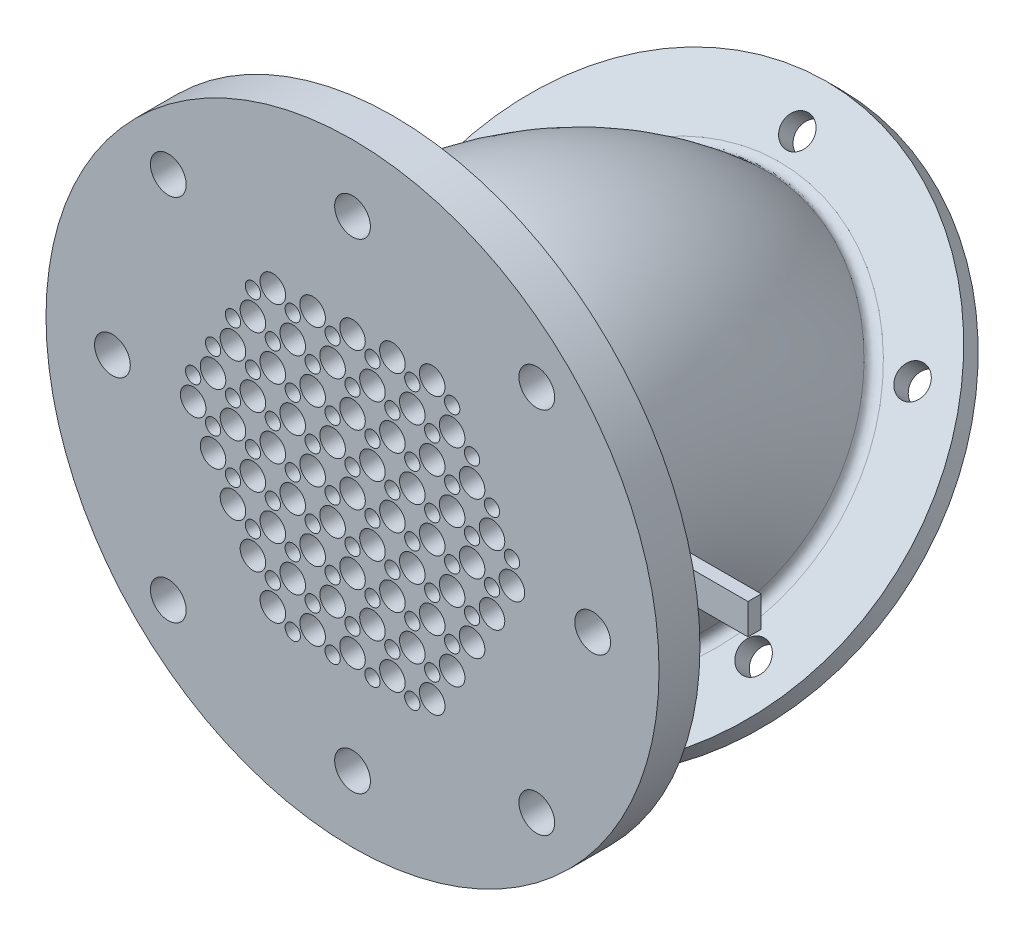
from build123d import *

# Parameters (mm, degrees)
SKETCH1_R           = 18.646817389
SKETCH1_R_2         = 1.25
SKETCH1_R_3         = 0.75
SKETCH5_R           = 30
SKETCH5_R_2         = 17.173669099
BOSS_EXTRUDE1_DEPTH = 4
FILLET1_R           = 2
SKETCH6_R           = 1.75
CUT_EXTRUDE2_DEPTH  = 5
SKETCH8_R           = 1.75
CUT_EXTRUDE3_DEPTH  = 5
SKETCH10_W          = 107.605507763
SKETCH10_H          = 80.053599659
CUT_EXTRUDE4_DEPTH  = 50
SKETCH12_W          = 12.253266611
SKETCH12_H          = 1.3
BOSS_EXTRUDE3_DEPTH = 1.5
SKETCH15_R          = 26
SKETCH15_R_2        = 17.590578727
BOSS_EXTRUDE6_DEPTH = 2
SKETCH16_R          = 1.5
CUT_EXTRUDE5_DEPTH  = 2
FILLET2_R           = 1


with BuildPart() as part:
    # Sweep1: sweep along a path in Sketch2
    with BuildLine(Plane(origin=(0, 0, 0), x_dir=(0, 0, -1), z_dir=(1, 0, 0))) as sweep1_path:
        Line((0, 0), (10, 0))
        ThreePointArc((10, 0), (29.391260893, -8.032123253), (37.423384146, -27.423384146))
        Line((37.423384146, -27.423384146), (37.423384146, -34.423384146))
    # Sketch1 → Sweep1 (sweep)
    with BuildSketch(Plane.XY):
        Circle(SKETCH1_R)
        Circle(SKETCH1_R_2, mode=Mode.SUBTRACT)
        with Locations((3.9, 0)):
            Circle(SKETCH1_R_2, mode=Mode.SUBTRACT)
        with Locations((7.8, 0)):
            Circle(SKETCH1_R_2, mode=Mode.SUBTRACT)
        with Locations((11.7, 0)):
            Circle(SKETCH1_R_2, mode=Mode.SUBTRACT)
        with Locations((15.6, 0)):
            Circle(SKETCH1_R_2, mode=Mode.SUBTRACT)
        with Locations((1.95, -3.377499075)):
            Circle(SKETCH1_R_2, mode=Mode.SUBTRACT)
        with Locations((3.9, -6.75499815)):
            Circle(SKETCH1_R_2, mode=Mode.SUBTRACT)
        with Locations((5.85, -10.132497224)):
            Circle(SKETCH1_R_2, mode=Mode.SUBTRACT)
        with Locations((7.8, -13.509996299)):
            Circle(SKETCH1_R_2, mode=Mode.SUBTRACT)
        with Locations((-1.95, -3.377499075)):
            Circle(SKETCH1_R_2, mode=Mode.SUBTRACT)
        with Locations((-3.9, -6.75499815)):
            Circle(SKETCH1_R_2, mode=Mode.SUBTRACT)
        with Locations((-5.85, -10.132497224)):
            Circle(SKETCH1_R_2, mode=Mode.SUBTRACT)
        with Locations((-7.8, -13.509996299)):
            Circle(SKETCH1_R_2, mode=Mode.SUBTRACT)
        with Locations((-3.9, 0)):
            Circle(SKETCH1_R_2, mode=Mode.SUBTRACT)
        with Locations((-7.8, 0)):
            Circle(SKETCH1_R_2, mode=Mode.SUBTRACT)
        with Locations((-11.7, 0)):
            Circle(SKETCH1_R_2, mode=Mode.SUBTRACT)
        with Locations((-15.6, 0)):
            Circle(SKETCH1_R_2, mode=Mode.SUBTRACT)
        with Locations((-1.95, 3.377499075)):
            Circle(SKETCH1_R_2, mode=Mode.SUBTRACT)
        with Locations((-3.9, 6.75499815)):
            Circle(SKETCH1_R_2, mode=Mode.SUBTRACT)
        with Locations((-5.85, 10.132497224)):
            Circle(SKETCH1_R_2, mode=Mode.SUBTRACT)
        with Locations((-7.8, 13.509996299)):
            Circle(SKETCH1_R_2, mode=Mode.SUBTRACT)
        with Locations((1.95, 3.377499075)):
            Circle(SKETCH1_R_2, mode=Mode.SUBTRACT)
        with Locations((3.9, 6.75499815)):
            Circle(SKETCH1_R_2, mode=Mode.SUBTRACT)
        with Locations((5.85, 10.132497224)):
            Circle(SKETCH1_R_2, mode=Mode.SUBTRACT)
        with Locations((7.8, 13.509996299)):
            Circle(SKETCH1_R_2, mode=Mode.SUBTRACT)
        with Locations((5.85, 3.377499075)):
            Circle(SKETCH1_R_2, mode=Mode.SUBTRACT)
        with Locations((7.8, 6.75499815)):
            Circle(SKETCH1_R_2, mode=Mode.SUBTRACT)
        with Locations((9.75, 3.377499075)):
            Circle(SKETCH1_R_2, mode=Mode.SUBTRACT)
        with Locations((11.7, 6.75499815)):
            Circle(SKETCH1_R_2, mode=Mode.SUBTRACT)
        with Locations((9.749099848, 10.134056333)):
            Circle(SKETCH1_R_2, mode=Mode.SUBTRACT)
        with Locations((13.650900152, 3.375939966)):
            Circle(SKETCH1_R_2, mode=Mode.SUBTRACT)
        with Locations((5.850000208, -3.379058003)):
            Circle(SKETCH1_R_2, mode=Mode.SUBTRACT)
        with Locations((9.750000208, -3.379058003)):
            Circle(SKETCH1_R_2, mode=Mode.SUBTRACT)
        with Locations((7.800000208, -6.756557078)):
            Circle(SKETCH1_R_2, mode=Mode.SUBTRACT)
        with Locations((11.700000208, -6.756557078)):
            Circle(SKETCH1_R_2, mode=Mode.SUBTRACT)
        with Locations((9.749100056, -10.135615261)):
            Circle(SKETCH1_R_2, mode=Mode.SUBTRACT)
        with Locations((13.650900359, -3.377498895)):
            Circle(SKETCH1_R_2, mode=Mode.SUBTRACT)
        with Locations((-0.00134976, -6.757336722)):
            Circle(SKETCH1_R_2, mode=Mode.SUBTRACT)
        with Locations((1.94865024, -10.134835797)):
            Circle(SKETCH1_R_2, mode=Mode.SUBTRACT)
        with Locations((-1.95134976, -10.134835797)):
            Circle(SKETCH1_R_2, mode=Mode.SUBTRACT)
        with Locations((-0.00134976, -13.512334872)):
            Circle(SKETCH1_R_2, mode=Mode.SUBTRACT)
        with Locations((-3.903150063, -13.512334872)):
            Circle(SKETCH1_R_2, mode=Mode.SUBTRACT)
        with Locations((3.900450543, -13.512334872)):
            Circle(SKETCH1_R_2, mode=Mode.SUBTRACT)
        with Locations((-5.852699936, -3.379058363)):
            Circle(SKETCH1_R_2, mode=Mode.SUBTRACT)
        with Locations((-7.802699936, -6.756557438)):
            Circle(SKETCH1_R_2, mode=Mode.SUBTRACT)
        with Locations((-9.752699936, -3.379058363)):
            Circle(SKETCH1_R_2, mode=Mode.SUBTRACT)
        with Locations((-11.702699936, -6.756557438)):
            Circle(SKETCH1_R_2, mode=Mode.SUBTRACT)
        with Locations((-13.653600087, -3.377499255)):
            Circle(SKETCH1_R_2, mode=Mode.SUBTRACT)
        with Locations((-9.751799784, -10.135615621)):
            Circle(SKETCH1_R_2, mode=Mode.SUBTRACT)
        with Locations((-5.852700144, 3.377498715)):
            Circle(SKETCH1_R_2, mode=Mode.SUBTRACT)
        with Locations((-9.752700144, 3.377498715)):
            Circle(SKETCH1_R_2, mode=Mode.SUBTRACT)
        with Locations((-7.802700144, 6.75499779)):
            Circle(SKETCH1_R_2, mode=Mode.SUBTRACT)
        with Locations((-11.702700144, 6.75499779)):
            Circle(SKETCH1_R_2, mode=Mode.SUBTRACT)
        with Locations((-9.751799992, 10.134055973)):
            Circle(SKETCH1_R_2, mode=Mode.SUBTRACT)
        with Locations((-13.653600295, 3.375939606)):
            Circle(SKETCH1_R_2, mode=Mode.SUBTRACT)
        with Locations((-0.001350176, 6.755777434)):
            Circle(SKETCH1_R_2, mode=Mode.SUBTRACT)
        with Locations((-1.951350176, 10.133276509)):
            Circle(SKETCH1_R_2, mode=Mode.SUBTRACT)
        with Locations((1.948649824, 10.133276509)):
            Circle(SKETCH1_R_2, mode=Mode.SUBTRACT)
        with Locations((-0.001350176, 13.510775583)):
            Circle(SKETCH1_R_2, mode=Mode.SUBTRACT)
        with Locations((3.900450128, 13.510775583)):
            Circle(SKETCH1_R_2, mode=Mode.SUBTRACT)
        with Locations((-3.903150479, 13.510775583)):
            Circle(SKETCH1_R_2, mode=Mode.SUBTRACT)
        with Locations((13.65, -1.125833025)):
            Circle(SKETCH1_R_3, mode=Mode.SUBTRACT)
        with Locations((11.700900359, -4.504371325)):
            Circle(SKETCH1_R_3, mode=Mode.SUBTRACT)
        with Locations((9.750000208, -7.883429509)):
            Circle(SKETCH1_R_3, mode=Mode.SUBTRACT)
        with Locations((7.798650344, -11.259109473)):
            Circle(SKETCH1_R_3, mode=Mode.SUBTRACT)
        with Locations((9.75, -1.125833025)):
            Circle(SKETCH1_R_3, mode=Mode.SUBTRACT)
        with Locations((7.800900359, -4.504371325)):
            Circle(SKETCH1_R_3, mode=Mode.SUBTRACT)
        with Locations((5.850000208, -7.883429509)):
            Circle(SKETCH1_R_3, mode=Mode.SUBTRACT)
        with Locations((3.898650344, -11.259109473)):
            Circle(SKETCH1_R_3, mode=Mode.SUBTRACT)
        with Locations((5.85, -1.125833025)):
            Circle(SKETCH1_R_3, mode=Mode.SUBTRACT)
        with Locations((3.900900359, -4.504371325)):
            Circle(SKETCH1_R_3, mode=Mode.SUBTRACT)
        with Locations((1.950000208, -7.883429509)):
            Circle(SKETCH1_R_3, mode=Mode.SUBTRACT)
        with Locations((-0.001349656, -11.259109473)):
            Circle(SKETCH1_R_3, mode=Mode.SUBTRACT)
        with Locations((1.95, -1.125833025)):
            Circle(SKETCH1_R_3, mode=Mode.SUBTRACT)
        with Locations((0.000900359, -4.504371325)):
            Circle(SKETCH1_R_3, mode=Mode.SUBTRACT)
        with Locations((-1.949999792, -7.883429509)):
            Circle(SKETCH1_R_3, mode=Mode.SUBTRACT)
        with Locations((-3.901349656, -11.259109473)):
            Circle(SKETCH1_R_3, mode=Mode.SUBTRACT)
        with Locations((-1.95, -1.125833025)):
            Circle(SKETCH1_R_3, mode=Mode.SUBTRACT)
        with Locations((-3.899099641, -4.504371325)):
            Circle(SKETCH1_R_3, mode=Mode.SUBTRACT)
        with Locations((-5.849999792, -7.883429509)):
            Circle(SKETCH1_R_3, mode=Mode.SUBTRACT)
        with Locations((-7.801349656, -11.259109473)):
            Circle(SKETCH1_R_3, mode=Mode.SUBTRACT)
        with Locations((-5.85, -1.125833025)):
            Circle(SKETCH1_R_3, mode=Mode.SUBTRACT)
        with Locations((-7.799099641, -4.504371325)):
            Circle(SKETCH1_R_3, mode=Mode.SUBTRACT)
        with Locations((-9.749999792, -7.883429509)):
            Circle(SKETCH1_R_3, mode=Mode.SUBTRACT)
        with Locations((-9.75, -1.125833025)):
            Circle(SKETCH1_R_3, mode=Mode.SUBTRACT)
        with Locations((-11.699099641, -4.504371325)):
            Circle(SKETCH1_R_3, mode=Mode.SUBTRACT)
        with Locations((-13.65, -1.125833025)):
            Circle(SKETCH1_R_3, mode=Mode.SUBTRACT)
        with Locations((0, 2.25166605)):
            Circle(SKETCH1_R_3, mode=Mode.SUBTRACT)
        with Locations((3.9, 2.25166605)):
            Circle(SKETCH1_R_3, mode=Mode.SUBTRACT)
        with Locations((7.8, 2.25166605)):
            Circle(SKETCH1_R_3, mode=Mode.SUBTRACT)
        with Locations((11.7, 2.25166605)):
            Circle(SKETCH1_R_3, mode=Mode.SUBTRACT)
        with Locations((15.6, 2.25166605)):
            Circle(SKETCH1_R_3, mode=Mode.SUBTRACT)
        with Locations((1.949100056, 5.629684708)):
            Circle(SKETCH1_R_3, mode=Mode.SUBTRACT)
        with Locations((5.849100056, 5.629684708)):
            Circle(SKETCH1_R_3, mode=Mode.SUBTRACT)
        with Locations((9.749100056, 5.629684708)):
            Circle(SKETCH1_R_3, mode=Mode.SUBTRACT)
        with Locations((13.649100056, 5.629684708)):
            Circle(SKETCH1_R_3, mode=Mode.SUBTRACT)
        with Locations((3.899100056, 9.007183782)):
            Circle(SKETCH1_R_3, mode=Mode.SUBTRACT)
        with Locations((7.799100056, 9.007183782)):
            Circle(SKETCH1_R_3, mode=Mode.SUBTRACT)
        with Locations((11.699100056, 9.007183782)):
            Circle(SKETCH1_R_3, mode=Mode.SUBTRACT)
        with Locations((5.85, 12.384163274)):
            Circle(SKETCH1_R_3, mode=Mode.SUBTRACT)
        with Locations((9.75, 12.384163274)):
            Circle(SKETCH1_R_3, mode=Mode.SUBTRACT)
        with Locations((5.85, -14.635829324)):
            Circle(SKETCH1_R_3, mode=Mode.SUBTRACT)
        with Locations((1.950899944, -14.635309741)):
            Circle(SKETCH1_R_3, mode=Mode.SUBTRACT)
        with Locations((-1.949100056, -14.635309741)):
            Circle(SKETCH1_R_3, mode=Mode.SUBTRACT)
        with Locations((-5.85, -14.635829324)):
            Circle(SKETCH1_R_3, mode=Mode.SUBTRACT)
        with Locations((-15.6, 2.25166605)):
            Circle(SKETCH1_R_3, mode=Mode.SUBTRACT)
        with Locations((-13.65, 5.628125959)):
            Circle(SKETCH1_R_3, mode=Mode.SUBTRACT)
        with Locations((-11.7, 9.005625033)):
            Circle(SKETCH1_R_3, mode=Mode.SUBTRACT)
        with Locations((-9.75, 12.384163274)):
            Circle(SKETCH1_R_3, mode=Mode.SUBTRACT)
        with Locations((-5.85, 12.384163274)):
            Circle(SKETCH1_R_3, mode=Mode.SUBTRACT)
        with Locations((-1.95, 12.384163274)):
            Circle(SKETCH1_R_3, mode=Mode.SUBTRACT)
        with Locations((1.95, 12.384163274)):
            Circle(SKETCH1_R_3, mode=Mode.SUBTRACT)
        with Locations((-7.8, 9.005625033)):
            Circle(SKETCH1_R_3, mode=Mode.SUBTRACT)
        with Locations((-9.75, 5.628125959)):
            Circle(SKETCH1_R_3, mode=Mode.SUBTRACT)
        with Locations((-11.7, 2.25166605)):
            Circle(SKETCH1_R_3, mode=Mode.SUBTRACT)
        with Locations((-3.9, 9.005625033)):
            Circle(SKETCH1_R_3, mode=Mode.SUBTRACT)
        with Locations((-5.85, 5.628125959)):
            Circle(SKETCH1_R_3, mode=Mode.SUBTRACT)
        with Locations((-7.8, 2.25166605)):
            Circle(SKETCH1_R_3, mode=Mode.SUBTRACT)
        with Locations((0, 9.005625033)):
            Circle(SKETCH1_R_3, mode=Mode.SUBTRACT)
        with Locations((-1.95, 5.628125959)):
            Circle(SKETCH1_R_3, mode=Mode.SUBTRACT)
        with Locations((-3.9, 2.25166605)):
            Circle(SKETCH1_R_3, mode=Mode.SUBTRACT)
    sweep(path=sweep1_path.line)

    # Sketch5 → Boss-Extrude1 (add)
    with BuildSketch(Plane.XY):
        Circle(SKETCH5_R)
        Circle(SKETCH5_R_2, mode=Mode.SUBTRACT)
    extrude(amount=-BOSS_EXTRUDE1_DEPTH)

    # Fillet1
    fillet1_edges = [part.edges().sort_by_distance(p)[0] for p in [
        (-18.646817389, 0, -4),
    ]]
    fillet(fillet1_edges, radius=FILLET1_R)

    # Sketch6 → Cut-Extrude2 (cut)
    with BuildSketch(Plane.XY):
        with Locations((23.5, 0)):
            Circle(SKETCH6_R)
        with Locations((0, -23.5)):
            Circle(SKETCH6_R)
        with Locations((-23.5, 0)):
            Circle(SKETCH6_R)
        with Locations((0, 23.5)):
            Circle(SKETCH6_R)
    extrude(amount=-CUT_EXTRUDE2_DEPTH, mode=Mode.SUBTRACT)

    # Sketch8 → Cut-Extrude3 (cut)
    with BuildSketch(Plane.XY):
        with Locations((18.03122292, 18.03122292)):
            Circle(SKETCH8_R)
        with Locations((-18.03122292, 18.03122292)):
            Circle(SKETCH8_R)
        with Locations((-18.03122292, -18.03122292)):
            Circle(SKETCH8_R)
        with Locations((18.03122292, -18.03122292)):
            Circle(SKETCH8_R)
    extrude(amount=-CUT_EXTRUDE3_DEPTH, mode=Mode.SUBTRACT)

    # Sketch10 → Cut-Extrude4 (cut)
    with BuildSketch(Plane(origin=(-1.577e-06, -18.711692073, -18.711692073), x_dir=(0, 0.7071067811865476, -0.7071067811865476), z_dir=(5.960464483662306e-08, 0.7071067811865464, 0.7071067811865464))):
        with Locations((7.049168622, 0.788612068)):
            Rectangle(SKETCH10_W, SKETCH10_H)
    extrude(amount=-CUT_EXTRUDE4_DEPTH, mode=Mode.SUBTRACT)

    # Sketch12 → Boss-Extrude3 (add, symmetric)
    with BuildSketch(Plane(origin=(0, 0, 0), x_dir=(1, 0, 0), z_dir=(0, 1, 0))):
        with Locations((23.873366695, 9.35)):
            Rectangle(SKETCH12_W, SKETCH12_H)
    extrude(amount=BOSS_EXTRUDE3_DEPTH, both=True)

    # Sketch15 → Boss-Extrude6 (add)
    with BuildSketch(Plane(origin=(-1.577e-06, -18.711692073, -18.711692073), x_dir=(0.9999999999999982, -4.2146848564731045e-08, -4.214684856473105e-08), z_dir=(-5.960464485152766e-08, -0.7071067811865464, -0.7071067811865462))):
        with Locations(Location((1.577e-06, -15.103191065, 0), (0, 0, 270))):
            Circle(SKETCH15_R)
        with Locations((1.577e-06, -15.103191065)):
            Circle(SKETCH15_R_2, mode=Mode.SUBTRACT)
    extrude(amount=-BOSS_EXTRUDE6_DEPTH)

    # Sketch16 → Cut-Extrude5 (cut)
    with BuildSketch(Plane(origin=(-1.577e-06, -18.711692073, -18.711692073), x_dir=(-0.9999999999999982, 4.2146848564731045e-08, 4.214684856473105e-08), z_dir=(-5.960464485152766e-08, -0.7071067811865464, -0.7071067811865462))):
        with Locations(Location((-1.577e-06, -6.896808935, 0), (0, 0, 90))):
            Circle(SKETCH16_R)
        with Locations(Location((-1.577e-06, 37.103191065, 0), (0, 0, 90))):
            Circle(SKETCH16_R)
        with Locations(Location((19.052557306, 4.103191065, 0), (0, 0, 90))):
            Circle(SKETCH16_R)
        with Locations(Location((-19.052560461, 26.103191065, 0), (0, 0, 90))):
            Circle(SKETCH16_R)
        with Locations(Location((-19.052560461, 4.103191065, 0), (0, 0, 90))):
            Circle(SKETCH16_R)
        with Locations(Location((19.052557306, 26.103191065, 0), (0, 0, 90))):
            Circle(SKETCH16_R)
    extrude(amount=-CUT_EXTRUDE5_DEPTH, mode=Mode.SUBTRACT)

    # Fillet2
    fillet2_edges = [part.edges().sort_by_distance(p)[0] for p in [
        (-18.646669267, -6.72224277, -27.872712679),
    ]]
    fillet(fillet2_edges, radius=FILLET2_R)


solid = part.part
